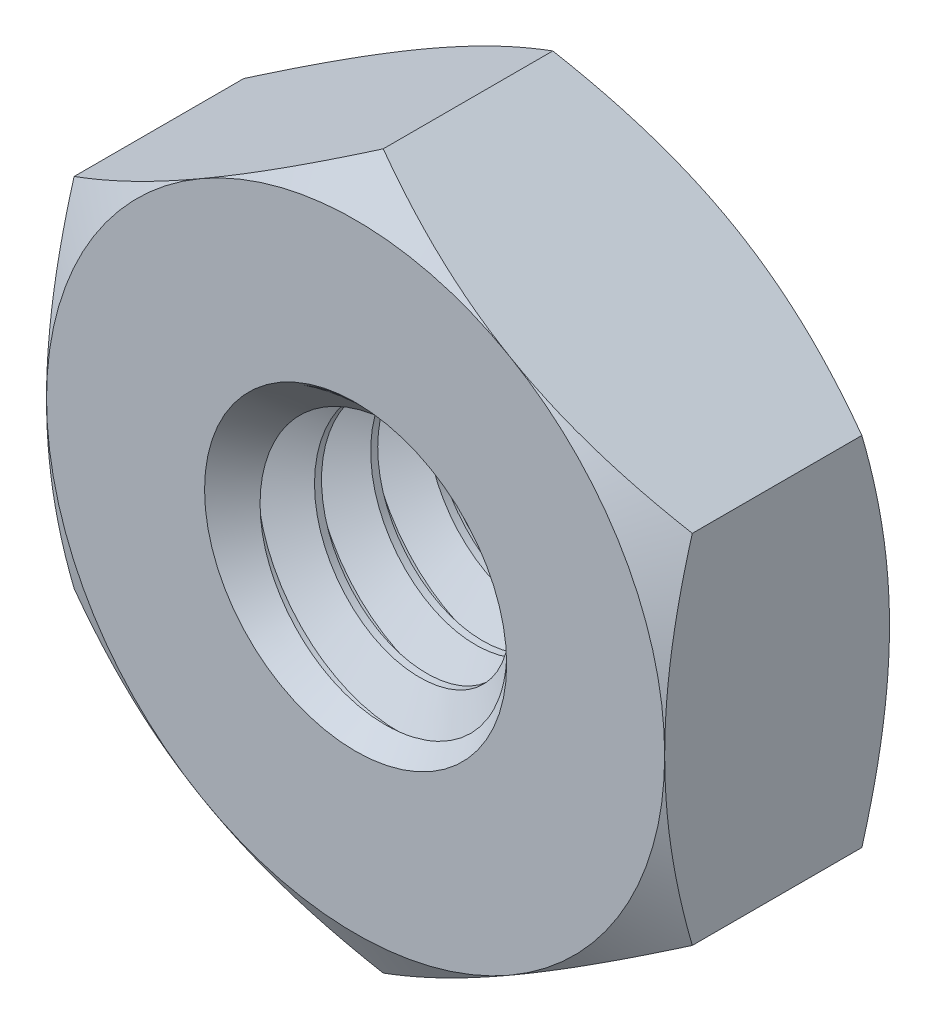
from build123d import *

# Parameters (mm, degrees)
EXTRUDE1_DEPTH     = 3.175
SKETCH2_OUTSIDE_W  = 42.524
SKETCH2_OUTSIDE_H  = 43.874
SKETCH2_OUTSIDE_R  = 4.365625
CUT_EXTRUDE6_DEPTH = 8.385856901
CUT_EXTRUDE6_DRAFT = -60
SKETCH4_OUTSIDE_W  = 35.472
SKETCH4_OUTSIDE_H  = 36.822
SKETCH4_OUTSIDE_R  = 4.365625
CUT_EXTRUDE3_DEPTH = 6.35
CUT_EXTRUDE3_DRAFT = -60
SKETCH5_R          = 2.0828
CUT_EXTRUDE4_DEPTH = 8.385856901
SWEEP1_PITCH       = 0.79375
SKETCH8_R          = 2.5908
CUT_EXTRUDE5_DEPTH = 10.208417836
CUT_EXTRUDE8_DEPTH = 8.385857003


with BuildPart() as part:
    # Sketch1 → Extrude1 (new body)
    with BuildSketch(Plane.XY):
        Polygon((0, 5.040989538), (-4.365625, 2.520494769), (-4.365625, -2.520494769), (0, -5.040989538), (4.365625, -2.520494769), (4.365625, 2.520494769), align=None)
    extrude(amount=-EXTRUDE1_DEPTH)


with BuildPart() as cut_extrude6_tool:
    # Sketch2 outside → Cut-Extrude6 (with draft: the straight prism first)
    with BuildSketch(Plane.XY):
        Rectangle(SKETCH2_OUTSIDE_W, SKETCH2_OUTSIDE_H)
        Circle(SKETCH2_OUTSIDE_R, mode=Mode.SUBTRACT)
    extrude(amount=-CUT_EXTRUDE6_DEPTH)
    # Cut-Extrude6: the draft: its side faces are tilted about the plane it starts from
    cut_extrude6_sides = [cut_extrude6_tool.faces().sort_by_distance(p)[0] for p in [
        (0, -21.937, -4.19292845),
        (21.262, 0, -4.19292845),
        (0, 21.937, -4.19292845),
        (-21.262, 0, -4.19292845),
        (-4.365625, 0, -4.19292845),
    ]]
    draft(cut_extrude6_sides, Plane.XY, CUT_EXTRUDE6_DRAFT)


with BuildPart() as part_1:
    add(part.part)

    # Cut-Extrude6: cut by cut_extrude6_tool
    add(cut_extrude6_tool.part, mode=Mode.SUBTRACT)


with BuildPart() as cut_extrude3_tool:
    # Sketch4 outside → Cut-Extrude3 (with draft: the straight prism first)
    with BuildSketch(Plane(origin=(0, 0, -3.175), x_dir=(-1, 0, 0), z_dir=(0, 0, -1))):
        Rectangle(SKETCH4_OUTSIDE_W, SKETCH4_OUTSIDE_H)
        Circle(SKETCH4_OUTSIDE_R, mode=Mode.SUBTRACT)
    extrude(amount=-CUT_EXTRUDE3_DEPTH)
    # Cut-Extrude3: the draft: its side faces are tilted about the plane it starts from
    cut_extrude3_sides = [cut_extrude3_tool.faces().sort_by_distance(p)[0] for p in [
        (0, -18.411, 0),
        (-17.736, 0, 0),
        (0, 18.411, 0),
        (17.736, 0, 0),
        (4.365625, 0, 0),
    ]]
    draft(cut_extrude3_sides, Plane(origin=(0, 0, -3.175), x_dir=(-1, 0, 0), z_dir=(0, 0, -1)), CUT_EXTRUDE3_DRAFT)


with BuildPart() as part_2:
    add(part_1.part)

    # Cut-Extrude3: cut by cut_extrude3_tool
    add(cut_extrude3_tool.part, mode=Mode.SUBTRACT)

    # Sketch5 → Cut-Extrude4 (cut, through all)
    with BuildSketch(Plane.XY):
        Circle(SKETCH5_R)
    extrude(amount=-CUT_EXTRUDE4_DEPTH, mode=Mode.SUBTRACT)

    # Sweep1: the profile of Sketch7 profile screwed along a right-hand helix of 12 turns, 6 arcs to a turn; built about Z, then put on its axis
    sweep1_z = Axis((0, 0, 0), (0, 0, 1))
    sweep1_corners = [(2.0831, 0, -0.694704455), (2.0831, 0, 0.000173205), (1.567244252, 0, -0.29765625), (1.567244252, 0, -0.396875)]
    with BuildLine(mode=Mode.PRIVATE) as sweep1_profile:
        Line(sweep1_corners[0], sweep1_corners[1])
        Line(sweep1_corners[1], sweep1_corners[2])
        Line(sweep1_corners[2], sweep1_corners[3])
        Line(sweep1_corners[3], sweep1_corners[0])
    sweep1_cap = Face(sweep1_profile.wire())
    sweep1_turn_angles = [0, 30, 60, 90, 120, 150, 180, 210, 240, 270, 300, 330, 360]
    sweep1_turn_weights = [1, 0.8660254037844387, 1, 0.8660254037844387, 1, 0.8660254037844387, 1, 0.8660254037844387, 1, 0.8660254037844387, 1, 0.8660254037844387, 1]
    sweep1_turn_rails = [Edge.make_bspline([Vector(p[0], p[1], 0).rotate(sweep1_z, sweep1_turn_angles[k]) / sweep1_turn_weights[k] + Vector(0, 0, p[2] + SWEEP1_PITCH * sweep1_turn_angles[k] / 360) for k in range(13)], [0, 0, 0, 1, 1, 2, 2, 3, 3, 4, 4, 5, 5, 6, 6, 6], 2, sweep1_turn_weights) for p in sweep1_corners]
    sweep1_turn_sides = [Face.make_surface_from_curves(sweep1_turn_rails[p[0]], sweep1_turn_rails[p[1]]) for p in [(0, 1), (1, 2), (2, 3), (3, 0)]]
    sweep1 = Plane(origin=(0, 0, 0), x_dir=(0, 1, 0), z_dir=(0, 0, -1)) * Solid(Shell([*[p.moved(Location((0, 0, SWEEP1_PITCH * i))) for i in range(12) for p in sweep1_turn_sides], sweep1_cap, sweep1_cap.rotate(sweep1_z, 4320).moved(Location((0, 0, SWEEP1_PITCH * 4320 / 360)))]))
    add(sweep1)

    # Sketch8 → Cut-Extrude5 (cut, through all)
    with BuildSketch(Plane(origin=(0, 0, -3.175), x_dir=(-1, 0, 0), z_dir=(0, 0, -1))):
        Circle(SKETCH8_R)
    extrude(amount=CUT_EXTRUDE5_DEPTH, mode=Mode.SUBTRACT)

    # Sketch10 → Cut-Extrude8 (cut, through all)
    with BuildSketch(Plane.XY):
        with BuildLine():
            ThreePointArc((2.1828125, -3.780742153), (3.780742153, -2.1828125), (4.365625, 0))
            ThreePointArc((4.365625, 0), (3.780742153, 2.1828125), (2.1828125, 3.780742153))
            ThreePointArc((2.1828125, 3.780742153), (0, 4.365625), (-2.1828125, 3.780742153))
            ThreePointArc((-2.1828125, 3.780742153), (-3.780742153, 2.1828125), (-4.365625, 0))
            ThreePointArc((-4.365625, 0), (-3.780742153, -2.1828125), (-2.1828125, -3.780742153))
            ThreePointArc((-2.1828125, -3.780742153), (0, -4.365625), (2.1828125, -3.780742153))
        make_face()
    extrude(amount=CUT_EXTRUDE8_DEPTH, mode=Mode.SUBTRACT)

    # Cut-Extrude7 cone 1 section (through the dimple's axis) → Cut-Extrude7 (revolve, cut)
    with BuildSketch(Plane(origin=(0, 0, -3.175), x_dir=(0, 1, 0), z_dir=(1, 0, 0))):
        Polygon((0, 0), (2.1336, 0), (0, 2.1336), align=None)
    revolve(axis=Axis((0, 0, -3.175), (0, 0, 1)), mode=Mode.SUBTRACT)

    # Cut-Extrude9 cone 1 section (through the dimple's axis) → Cut-Extrude9 (revolve, cut)
    with BuildSketch(Plane(origin=(0, 0, 0), x_dir=(0, -1, 0), z_dir=(1, 0, 0))):
        Polygon((0, 0), (2.1336, 0), (0, 2.1336), align=None)
    revolve(axis=Axis((0, 0, 0), (0, 0, -1)), mode=Mode.SUBTRACT)


solid = part_2.part
